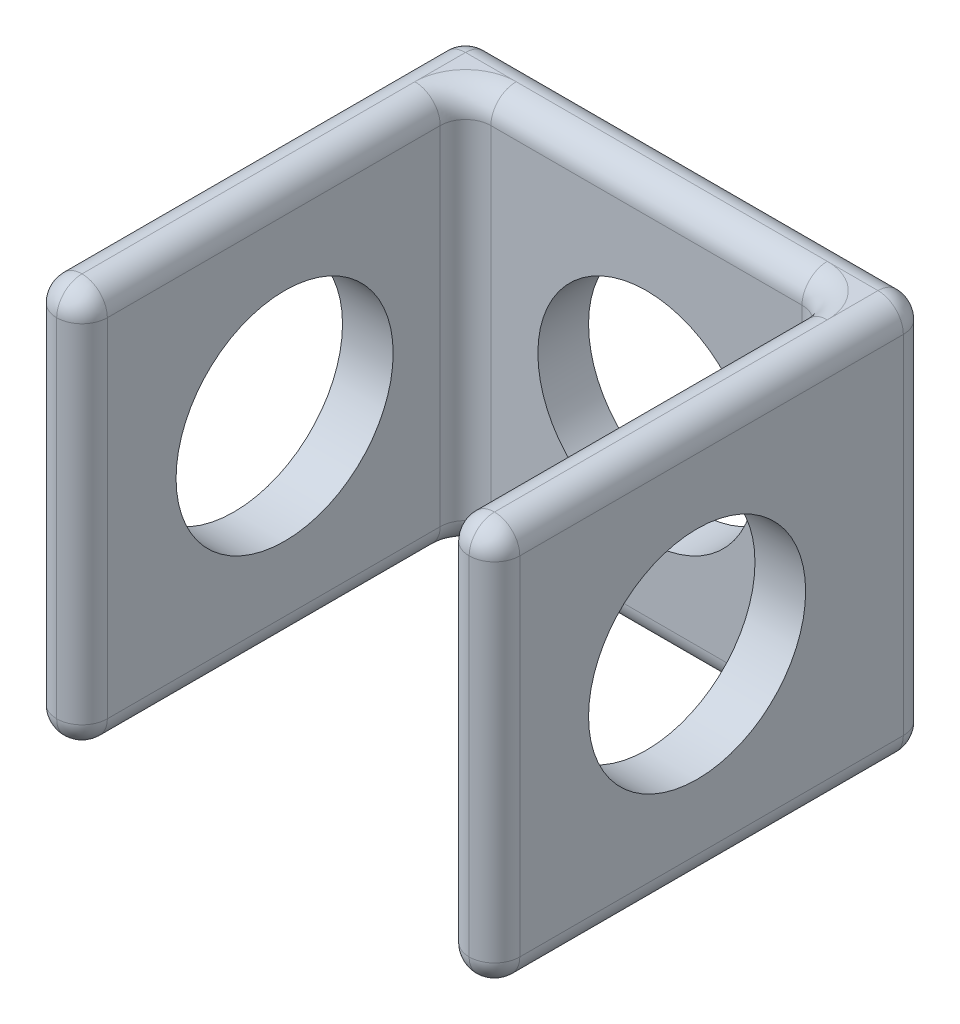
from build123d import *

# Parameters (mm, degrees)
SKETCH1_W           = 128
SKETCH1_H           = 120
BOSS_EXTRUDE1_DEPTH = 110
SKETCH2_W           = 100
SKETCH2_H           = 106
CUT_EXTRUDE2_DEPTH  = 208.084523806
SKETCH3_R           = 30
CUT_EXTRUDE3_DEPTH  = 208.084523806
SKETCH4_R           = 30
CUT_EXTRUDE4_DEPTH  = 200.298770694
FILLET1_R           = 7


with BuildPart() as part:
    # Sketch1 → Boss-Extrude1 (new body)
    with BuildSketch(Plane(origin=(0, 0, 0), x_dir=(1, 0, 0), z_dir=(0, 1, 0))):
        with Locations((64, 60)):
            Rectangle(SKETCH1_W, SKETCH1_H)
    extrude(amount=BOSS_EXTRUDE1_DEPTH)

    # Sketch2 → Cut-Extrude2 (cut, through all)
    with BuildSketch(Plane(origin=(0, 110, 0), x_dir=(1, 0, 0), z_dir=(0, 1, 0))):
        with Locations((64, 53)):
            Rectangle(SKETCH2_W, SKETCH2_H)
    extrude(amount=-CUT_EXTRUDE2_DEPTH, mode=Mode.SUBTRACT)

    # Sketch3 → Cut-Extrude3 (cut, through all)
    with BuildSketch(Plane.ZY):
        with Locations((-56, 55)):
            Circle(SKETCH3_R)
    extrude(amount=-CUT_EXTRUDE3_DEPTH, mode=Mode.SUBTRACT)

    # Sketch4 → Cut-Extrude4 (cut, through all)
    with BuildSketch(Plane.XY.offset(-106)):
        with Locations((64, 55)):
            Circle(SKETCH4_R)
    extrude(amount=-CUT_EXTRUDE4_DEPTH, mode=Mode.SUBTRACT)

    # Fillet1
    fillet1_edges = [part.edges().sort_by_distance(p)[0] for p in [
        (128, 110, -60),
        (121, 0, 0),
        (64, 110, -120),
        (121, 110, 0),
        (114, 55, 0),
        (14, 0, -53),
        (14, 55, 0),
        (64, 0, -106),
        (14, 55, -106),
        (114, 0, -53),
        (114, 55, -106),
        (114, 110, -53),
        (64, 110, -106),
        (14, 110, -53),
        (0, 110, -60),
        (64, 0, -120),
        (128, 0, -60),
        (7, 0, 0),
        (0, 0, -60),
        (0, 55, -120),
        (128, 55, -120),
        (128, 55, 0),
        (0, 55, 0),
        (7, 110, 0),
    ]]
    fillet(fillet1_edges, radius=FILLET1_R - 0.0001)  # a hair under: the kernel refuses the full size


solid = part.part
